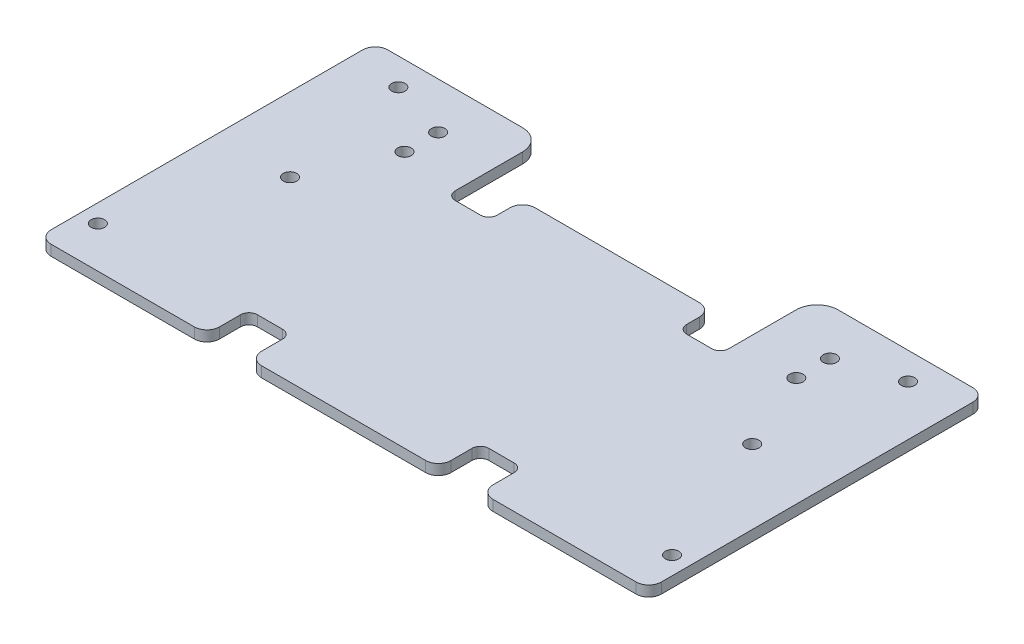
from build123d import *

# Parameters (mm, degrees)
BOSS_EXTRUDE1_DEPTH = 3.175
FILLET1_R           = 3.81
SKETCH2_R           = 2.032
CUT_EXTRUDE1_DEPTH  = 211.342252353
FILLET2_R           = 6.35
FILLET3_R           = 2.54
FILLET4_R           = 3.81
FILLET5_R           = 3.81


with BuildPart() as part:
    # Sketch1 → Boss-Extrude1 (new body)
    with BuildSketch(Plane(origin=(0, 0, 0), x_dir=(1, 0, 0), z_dir=(0, 1, 0))):
        Polygon((50.8, 0), (0, 0), (0, -101.6), (50.8, -101.6), (50.8, -88.9), (63.5, -88.9), (63.5, -101.6), (120.65, -101.6), (120.65, -88.9), (133.35, -88.9), (133.35, -101.6), (184.15, -101.6), (184.15, 0), (133.35, 0), (133.35, -29.21), (120.65, -29.21), (120.65, -19.05), (63.5, -19.05), (63.5, -29.21), (50.8, -29.21), align=None)
    extrude(amount=BOSS_EXTRUDE1_DEPTH)

    # Fillet1
    fillet1_edges = [part.edges().sort_by_distance(p)[0] for p in [
        (184.15, 1.5875, 101.6),
        (0, 1.5875, 101.6),
        (184.15, 1.5875, 0),
        (0, 1.5875, 0),
    ]]
    fillet(fillet1_edges, radius=FILLET1_R)

    # Sketch2 → Cut-Extrude1 (cut, through all)
    with BuildSketch(Plane(origin=(0, 3.175, 0), x_dir=(1, 0, 0), z_dir=(0, 1, 0))):
        with Locations((15.16630044, -8.195189781)):
            Circle(SKETCH2_R)
        with Locations((22.338907609, -48.03498858)):
            Circle(SKETCH2_R)
        with Locations((5.437401114, -89.146320086)):
            Circle(SKETCH2_R)
        with Locations((32.94630044, -24.13)):
            Circle(SKETCH2_R)
        with Locations((32.94630044, -13.97)):
            Circle(SKETCH2_R)
        with Locations((151.20369956, -13.97)):
            Circle(SKETCH2_R)
        with Locations((151.20369956, -24.13)):
            Circle(SKETCH2_R)
        with Locations((161.811092391, -48.03498858)):
            Circle(SKETCH2_R)
        with Locations((168.98369956, -8.195189781)):
            Circle(SKETCH2_R)
        with Locations((178.712598886, -89.146320086)):
            Circle(SKETCH2_R)
    extrude(amount=-CUT_EXTRUDE1_DEPTH, mode=Mode.SUBTRACT)

    # Fillet2
    fillet2_edges = [part.edges().sort_by_distance(p)[0] for p in [
        (50.8, 1.5875, 0),
        (133.35, 1.5875, 0),
    ]]
    fillet(fillet2_edges, radius=FILLET2_R)

    # Fillet3
    fillet3_edges = [part.edges().sort_by_distance(p)[0] for p in [
        (133.35, 1.5875, 29.21),
        (120.65, 1.5875, 29.21),
        (50.8, 1.5875, 29.21),
        (63.5, 1.5875, 29.21),
        (133.35, 1.5875, 88.9),
        (120.65, 1.5875, 88.9),
        (63.5, 1.5875, 88.9),
        (50.8, 1.5875, 88.9),
    ]]
    fillet(fillet3_edges, radius=FILLET3_R)

    # Fillet4
    fillet4_edges = [part.edges().sort_by_distance(p)[0] for p in [
        (120.65, 1.5875, 19.05),
        (63.5, 1.5875, 19.05),
    ]]
    fillet(fillet4_edges, radius=FILLET4_R)

    # Fillet5
    fillet5_edges = [part.edges().sort_by_distance(p)[0] for p in [
        (133.35, 1.5875, 101.6),
        (120.65, 1.5875, 101.6),
        (63.5, 1.5875, 101.6),
        (50.8, 1.5875, 101.6),
    ]]
    fillet(fillet5_edges, radius=FILLET5_R)


solid = part.part
